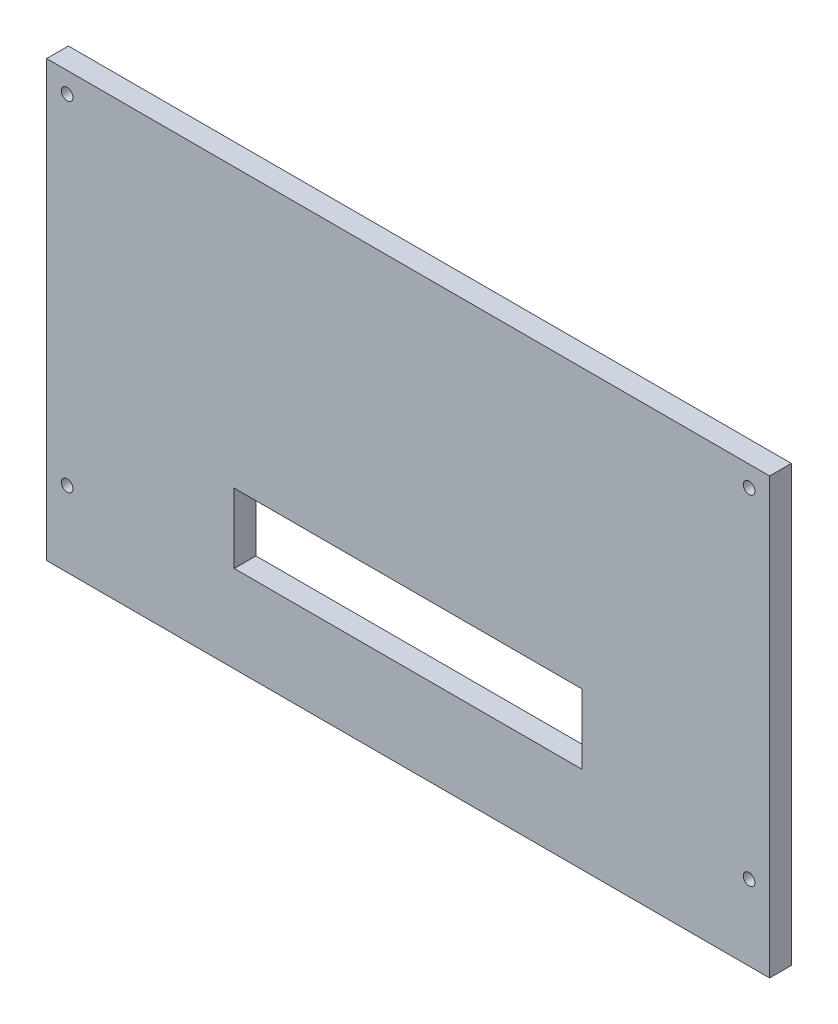
from build123d import *

# Parameters (mm, degrees)
SKETCH1_W            = 211.1756
SKETCH1_H            = 127
BOSS_EXTRUDE1_DEPTH  = 6.35
M3_CLEARANCE_HOLE1_D = 3.4
SKETCH7_W            = 101.6
SKETCH7_H            = 20.32
TUBINGSLOT_DEPTH     = 247.50447569


with BuildPart() as part:
    # Sketch1 → Boss-Extrude1 (new body)
    with BuildSketch(Plane.XY):
        with Locations((105.5878, 63.5)):
            Rectangle(SKETCH1_W, SKETCH1_H)
    extrude(amount=BOSS_EXTRUDE1_DEPTH)

    # M3 Clearance Hole1 (through all)
    with Locations(Plane.XY.offset(6.35)):
        with Locations((5.9944, 121.0056), (5.9944, 21.9964), (205.1812, 21.9964), (205.1812, 121.0056)):
            Hole(M3_CLEARANCE_HOLE1_D / 2)

    # Sketch7 → tubingslot (cut, through all)
    with BuildSketch(Plane.XY.offset(6.35)):
        with Locations((105.5878, 35.56)):
            Rectangle(SKETCH7_W, SKETCH7_H)
    extrude(amount=-TUBINGSLOT_DEPTH, mode=Mode.SUBTRACT)


solid = part.part
